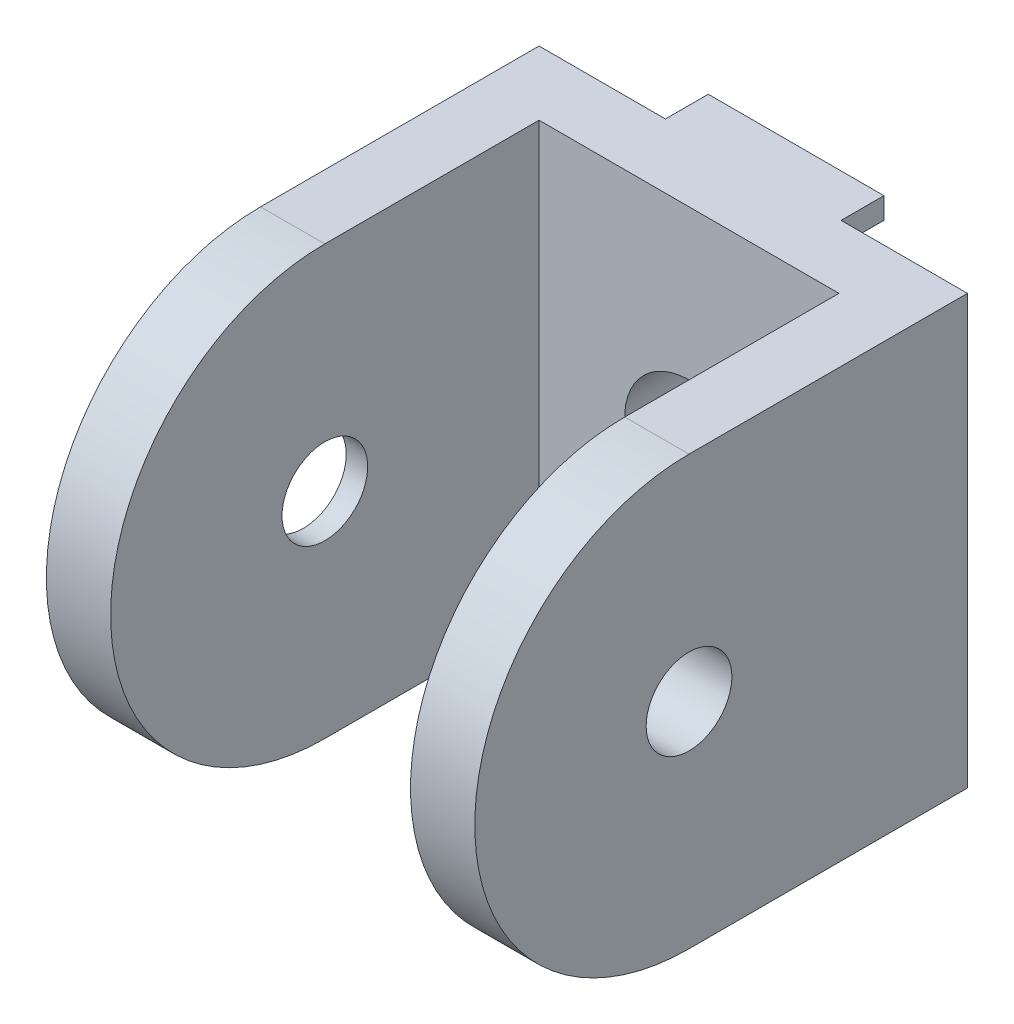
from build123d import *

# Parameters (mm, degrees)
SKETCH_1_W          = 20
SKETCH_1_H          = 20
EXTRUDE_1_DEPTH     = 3
SKETCH_2_W          = 3
SKETCH_2_H          = 20
EXTRUDE_2_DEPTH     = 20
CUT_EXTRUDE_START   = -20
CUT_EXTRUDE_2_DEPTH = 20
SKETCH_4_R          = 2
CUT_EXTRUDE_3_DEPTH = 33.078029865
SKETCH_5_R          = 5
CUT_EXTRUDE_4_DEPTH = 2
SKETCH_6_R          = 3
CUT_EXTRUDE_5_DEPTH = 25.494897428
SKETCH_7_W          = 8.2
SKETCH_7_H          = 1
EXTRUDE_3_DEPTH     = 2


# Read off the part's stored shape, not the designer's step: 切除-拉伸2
with BuildPart() as part:
    # 草图1 → 凸台-拉伸1 (new body)
    with BuildSketch(Plane.XY):
        Rectangle(SKETCH_1_W, SKETCH_1_H)
    extrude(amount=EXTRUDE_1_DEPTH)

    # 草图2 → 凸台-拉伸2 (add)
    with BuildSketch(Plane.XY.offset(3)):
        with Locations((-8.5, 0)):
            Rectangle(SKETCH_2_W, SKETCH_2_H)
        with Locations((8.5, 0)):
            Rectangle(SKETCH_2_W, SKETCH_2_H)
    extrude(amount=EXTRUDE_2_DEPTH)

    # 切除-拉伸2 outline → 切除-拉伸2 (cut)
    with BuildSketch(Plane.ZY.offset(10).offset(CUT_EXTRUDE_START)):
        with BuildLine():
            Line((23, 10), (13, 10))
            ThreePointArc((13, 10), (20.071067812, 7.071067812), (23, 0))
            Line((23, 0), (23, 10))
        make_face()
        with BuildLine():
            Line((23, -10), (23, 0))
            ThreePointArc((23, 0), (20.071067812, -7.071067812), (13, -10))
            Line((13, -10), (23, -10))
        make_face()
    extrude(amount=CUT_EXTRUDE_2_DEPTH, mode=Mode.SUBTRACT)

    # 草图4 → 切除-拉伸3 (cut, through all)
    with BuildSketch(Plane.ZY.offset(10)):
        with Locations((13, 0)):
            Circle(SKETCH_4_R)
    extrude(amount=-CUT_EXTRUDE_3_DEPTH, mode=Mode.SUBTRACT)

    # 草图5 → 切除-拉伸4 (cut)
    with BuildSketch(Plane.ZY.offset(10)):
        with Locations((13, 0)):
            Circle(SKETCH_5_R)
    extrude(amount=-CUT_EXTRUDE_4_DEPTH, mode=Mode.SUBTRACT)

    # 草图6 → 切除-拉伸5 (cut, through all)
    with BuildSketch(Plane.XY.offset(3)):
        Circle(SKETCH_6_R)
    extrude(amount=-CUT_EXTRUDE_5_DEPTH, mode=Mode.SUBTRACT)

    # 草图7 → 凸台-拉伸3 (add)
    with BuildSketch(Plane(origin=(0, 0, 0), x_dir=(-1, 0, 0), z_dir=(0, 0, -1))):
        with Locations((0, 9.5)):
            Rectangle(SKETCH_7_W, SKETCH_7_H)
        with Locations((0, -9.5)):
            Rectangle(SKETCH_7_W, SKETCH_7_H)
    extrude(amount=EXTRUDE_3_DEPTH)


solid = part.part
